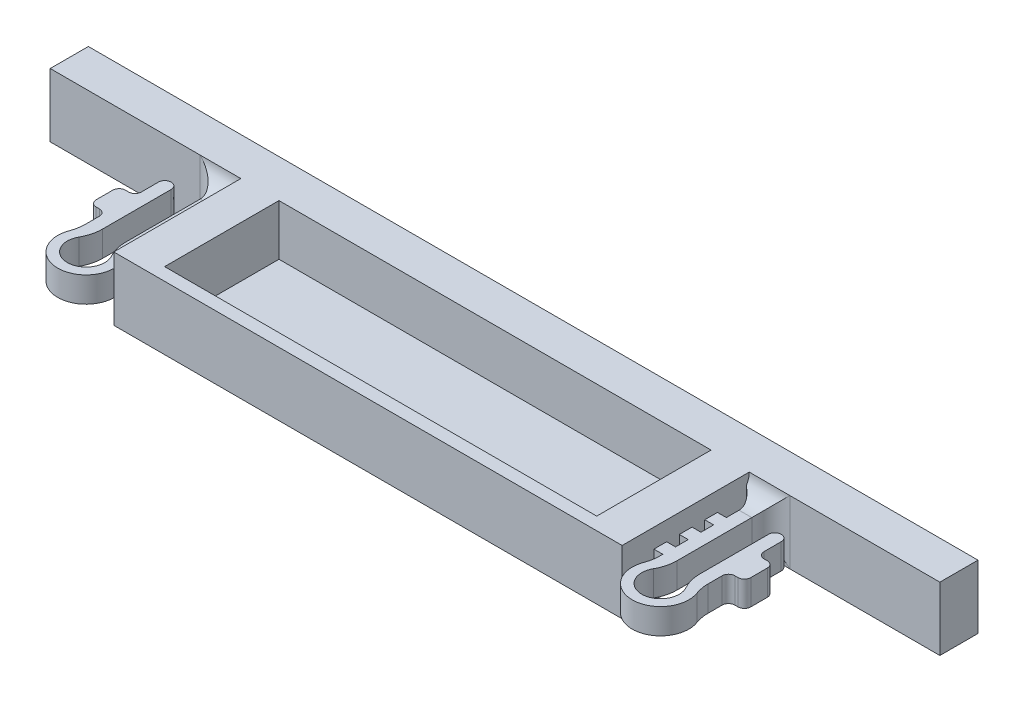
from build123d import *

# Parameters (mm, degrees)
BOSS_EXTRUDE1_DEPTH = 12.7
SKETCH6_W           = 86.36
SKETCH6_H           = 22.86
CUT_EXTRUDE3_DEPTH  = 10.16
SKETCH7_W           = 12.7
SKETCH7_H           = 25.4
CUT_EXTRUDE4_DEPTH  = 12.7
SKETCH14_W          = 88.9
SKETCH14_H          = 33.02
CUT_EXTRUDE5_DEPTH  = 19.558
BOSS_EXTRUDE2_START = -3.81
SKETCH15_W          = 2.54
SKETCH15_H          = 21.363451449
SKETCH15_W_2        = 3.175
SKETCH15_H_2        = 5.842
BOSS_EXTRUDE2_DEPTH = 5.08
FILLET1_R           = 7.62
FILLET2_R           = 1.27
FILLET3_R           = 3.81
BOSS_EXTRUDE3_START = -3.81
SKETCH16_W          = 1.778
SKETCH16_H          = 2.54
BOSS_EXTRUDE3_DEPTH = 5.08


# Some blends are built 0.0001 mm under size
with BuildPart() as part:
    # Sketch1 → Boss-Extrude1 (new body)
    with BuildSketch(Plane(origin=(0, 0, 0), x_dir=(1, 0, 0), z_dir=(0, 1, 0))):
        Polygon((88.9, 16.51), (-88.9, 16.51), (-88.9, 8.89), (-63.5, 8.89), (-63.5, -16.51), (63.5, -16.51), (63.5, 8.89), (88.9, 8.89), align=None)
    extrude(amount=BOSS_EXTRUDE1_DEPTH)

    # Sketch6 → Cut-Extrude3 (cut)
    with BuildSketch(Plane(origin=(0, 12.7, 0), x_dir=(1, 0, 0), z_dir=(0, 1, 0))):
        with Locations((0, -2.54)):
            Rectangle(SKETCH6_W, SKETCH6_H)
    extrude(amount=-CUT_EXTRUDE3_DEPTH, mode=Mode.SUBTRACT)

    # Sketch7 → Cut-Extrude4 (cut)
    with BuildSketch(Plane(origin=(0, 12.7, 0), x_dir=(1, 0, 0), z_dir=(0, 1, 0))):
        with Locations((57.15, -3.81)):
            Rectangle(SKETCH7_W, SKETCH7_H)
        with Locations((-57.15, -3.81)):
            Rectangle(SKETCH7_W, SKETCH7_H)
    extrude(amount=-CUT_EXTRUDE4_DEPTH, mode=Mode.SUBTRACT)

    # Sketch14 → Cut-Extrude5 (cut)
    with BuildSketch(Plane(origin=(0, 12.7, 0), x_dir=(1, 0, 0), z_dir=(0, 1, 0))):
        with Locations((44.45, 0)):
            Rectangle(SKETCH14_W, SKETCH14_H)
    extrude(amount=-CUT_EXTRUDE5_DEPTH, mode=Mode.SUBTRACT)

    # Sketch15 → Boss-Extrude2 (add)
    with BuildSketch(Plane(origin=(0, 12.7, 0), x_dir=(1, 0, 0), z_dir=(0, 1, 0)).offset(BOSS_EXTRUDE2_START)):
        with Locations((-53.848, -1.791725725)):
            Rectangle(SKETCH15_W, SKETCH15_H)
        with BuildLine():
            ThreePointArc((-59.69, -12.473451449), (-57.404, -19.184020308), (-55.118, -12.473451449))
            Line((-55.118, -12.473451449), (-52.578, -12.473451449))
            ThreePointArc((-52.578, -12.473451449), (-57.404, -21.103897158), (-62.23, -12.473451449))
            Line((-62.23, -12.473451449), (-62.23, 5.125982646))
            Line((-62.23, 5.125982646), (-59.69, 5.125982646))
            Line((-59.69, 5.125982646), (-59.69, -12.473451449))
        make_face()
        with Locations((-63.8175, -3.758774926)):
            Rectangle(SKETCH15_W_2, SKETCH15_H_2)
    extrude(amount=-BOSS_EXTRUDE2_DEPTH)

    # Fillet1
    fillet1_edges = [part.edges().sort_by_distance(p)[0] for p in [
        (-59.69, 6.35, 12.473451449),
        (-55.118, 6.35, 12.473451449),
        (-62.23, 6.35, 12.473451449),
        (-52.578, 6.35, 12.473451449),
    ]]
    fillet(fillet1_edges, radius=FILLET1_R)

    # Fillet2
    fillet2_edges = [part.edges().sort_by_distance(p)[0] for p in [
        (-62.23, 6.35, 6.679774926),
        (-65.405, 6.35, 6.679774926),
        (-65.405, 6.35, 0.837774926),
        (-62.23, 6.35, 0.837774926),
        (-59.69, 6.35, -5.125982646),
        (-62.23, 6.35, -5.125982646),
    ]]
    fillet(fillet2_edges, radius=FILLET2_R - 0.0001)  # a hair under: the kernel refuses the full size

    # Fillet3
    # the kernel refuses this fillet: 3.81 mm, written as the material it adds along each edge
    with BuildSketch(Plane(origin=(-52.578, 8.89, -8.89), x_dir=(0, 0, 1), z_dir=(0, -1, 0)), Plane(origin=(-55.118, 8.89, -8.89), x_dir=(-1, 0, 0), z_dir=(0, -1, 0))) as fillet3_piece_1:
        with BuildLine():
            CenterArc((FILLET3_R, -FILLET3_R), FILLET3_R, 90, 90)
            Line((0, -FILLET3_R), (-FILLET3_R * 0.02, -FILLET3_R))
            Line((-FILLET3_R * 0.02, -FILLET3_R), (-FILLET3_R * 0.02, FILLET3_R * 0.02))
            Line((-FILLET3_R * 0.02, FILLET3_R * 0.02), (FILLET3_R, FILLET3_R * 0.02))
            Line((FILLET3_R, FILLET3_R * 0.02), (FILLET3_R, 0))
        make_face()
    extrude(amount=5.08)
    with BuildSketch(Plane(origin=(-52.578, 3.81, -8.89), x_dir=(0, -1, 0), z_dir=(-1, 0, 0)), Plane(origin=(-52.578, 8.89, -8.89), x_dir=(0, 0, 1), z_dir=(-1, 0, 0))) as fillet3_piece_2:
        with BuildLine():
            CenterArc((FILLET3_R, FILLET3_R), FILLET3_R, 180, 90)
            Line((0, FILLET3_R), (-FILLET3_R * 0.02, FILLET3_R))
            Line((-FILLET3_R * 0.02, FILLET3_R), (-FILLET3_R * 0.02, -FILLET3_R * 0.02))
            Line((-FILLET3_R * 0.02, -FILLET3_R * 0.02), (FILLET3_R, -FILLET3_R * 0.02))
            Line((FILLET3_R, -FILLET3_R * 0.02), (FILLET3_R, 0))
        make_face()
    extrude(amount=2.54)
    with BuildSketch(Plane(origin=(-43.053, 8.89, -8.89), x_dir=(0, 0, 1), z_dir=(-1, 0, 0))) as fillet3_piece_3a_section:
        with BuildLine():
            CenterArc((FILLET3_R, FILLET3_R), FILLET3_R, 180, 90)
            Line((0, FILLET3_R), (-FILLET3_R * 0.02, FILLET3_R))
            Line((-FILLET3_R * 0.02, FILLET3_R), (-FILLET3_R * 0.02, -FILLET3_R * 0.02))
            Line((-FILLET3_R * 0.02, -FILLET3_R * 0.02), (FILLET3_R, -FILLET3_R * 0.02))
            Line((FILLET3_R, -FILLET3_R * 0.02), (FILLET3_R, 0))
        make_face()
    fillet3_piece_3a = extrude(amount=12.065, mode=Mode.PRIVATE)
    fillet3_piece_3a = split(fillet3_piece_3a, bisect_by=Plane(origin=(-52.578, 9.752565385, -8.027434615), z_dir=(1, 0, 0)), keep=Keep.TOP, mode=Mode.PRIVATE)
    with BuildSketch(Plane(origin=(-52.578, 18.415, -8.89), x_dir=(0, 0, 1), z_dir=(0, -1, 0))) as fillet3_piece_3b_section:
        with BuildLine():
            CenterArc((FILLET3_R, -FILLET3_R), FILLET3_R, 90, 90)
            Line((0, -FILLET3_R), (-FILLET3_R * 0.02, -FILLET3_R))
            Line((-FILLET3_R * 0.02, -FILLET3_R), (-FILLET3_R * 0.02, FILLET3_R * 0.02))
            Line((-FILLET3_R * 0.02, FILLET3_R * 0.02), (FILLET3_R, FILLET3_R * 0.02))
            Line((FILLET3_R, FILLET3_R * 0.02), (FILLET3_R, 0))
        make_face()
    fillet3_piece_3b = extrude(amount=14.605, mode=Mode.PRIVATE)
    fillet3_piece_3b = split(fillet3_piece_3b, bisect_by=Plane(origin=(-51.715434615, 8.89, -8.027434615), z_dir=(0, 1, 0)), keep=Keep.TOP, mode=Mode.PRIVATE)
    fillet3_piece_3 = fillet3_piece_3a & fillet3_piece_3b
    add(fillet3_piece_3)
    with BuildSketch(Plane(origin=(-52.578, 8.89, -8.89), x_dir=(0, 0, 1), z_dir=(0, -1, 0))) as fillet3_piece_4a_section:
        with BuildLine():
            CenterArc((FILLET3_R, -FILLET3_R), FILLET3_R, 90, 90)
            Line((0, -FILLET3_R), (-FILLET3_R * 0.02, -FILLET3_R))
            Line((-FILLET3_R * 0.02, -FILLET3_R), (-FILLET3_R * 0.02, FILLET3_R * 0.02))
            Line((-FILLET3_R * 0.02, FILLET3_R * 0.02), (FILLET3_R, FILLET3_R * 0.02))
            Line((FILLET3_R, FILLET3_R * 0.02), (FILLET3_R, 0))
        make_face()
    fillet3_piece_4a = extrude(amount=14.605, mode=Mode.PRIVATE)
    fillet3_piece_4a = split(fillet3_piece_4a, bisect_by=Plane(origin=(-51.715434615, 3.81, -8.027434615), z_dir=(0, -1, 0)), keep=Keep.TOP, mode=Mode.PRIVATE)
    with BuildSketch(Plane(origin=(-43.053, 3.81, -8.89), x_dir=(0, -1, 0), z_dir=(-1, 0, 0))) as fillet3_piece_4b_section:
        with BuildLine():
            CenterArc((FILLET3_R, FILLET3_R), FILLET3_R, 180, 90)
            Line((0, FILLET3_R), (-FILLET3_R * 0.02, FILLET3_R))
            Line((-FILLET3_R * 0.02, FILLET3_R), (-FILLET3_R * 0.02, -FILLET3_R * 0.02))
            Line((-FILLET3_R * 0.02, -FILLET3_R * 0.02), (FILLET3_R, -FILLET3_R * 0.02))
            Line((FILLET3_R, -FILLET3_R * 0.02), (FILLET3_R, 0))
        make_face()
    fillet3_piece_4b = extrude(amount=12.065, mode=Mode.PRIVATE)
    fillet3_piece_4b = split(fillet3_piece_4b, bisect_by=Plane(origin=(-52.578, 2.947434615, -8.027434615), z_dir=(1, 0, 0)), keep=Keep.TOP, mode=Mode.PRIVATE)
    fillet3_piece_4 = fillet3_piece_4a & fillet3_piece_4b
    add(fillet3_piece_4)
    with BuildSketch(Plane(origin=(-52.578, 8.89, -8.89), x_dir=(0, 0, 1), z_dir=(-1, 0, 0))) as fillet3_piece_5a_section:
        with BuildLine():
            CenterArc((FILLET3_R, FILLET3_R), FILLET3_R, 180, 90)
            Line((0, FILLET3_R), (-FILLET3_R * 0.02, FILLET3_R))
            Line((-FILLET3_R * 0.02, FILLET3_R), (-FILLET3_R * 0.02, -FILLET3_R * 0.02))
            Line((-FILLET3_R * 0.02, -FILLET3_R * 0.02), (FILLET3_R, -FILLET3_R * 0.02))
            Line((FILLET3_R, -FILLET3_R * 0.02), (FILLET3_R, 0))
        make_face()
    fillet3_piece_5a = extrude(amount=12.065, mode=Mode.PRIVATE)
    fillet3_piece_5a = split(fillet3_piece_5a, bisect_by=Plane(origin=(-55.118, 9.752565385, -8.027434615), z_dir=(-1, 0, 0)), keep=Keep.TOP, mode=Mode.PRIVATE)
    with BuildSketch(Plane(origin=(-55.118, 18.415, -8.89), x_dir=(-1, 0, 0), z_dir=(0, -1, 0))) as fillet3_piece_5b_section:
        with BuildLine():
            CenterArc((FILLET3_R, -FILLET3_R), FILLET3_R, 90, 90)
            Line((0, -FILLET3_R), (-FILLET3_R * 0.02, -FILLET3_R))
            Line((-FILLET3_R * 0.02, -FILLET3_R), (-FILLET3_R * 0.02, FILLET3_R * 0.02))
            Line((-FILLET3_R * 0.02, FILLET3_R * 0.02), (FILLET3_R, FILLET3_R * 0.02))
            Line((FILLET3_R, FILLET3_R * 0.02), (FILLET3_R, 0))
        make_face()
    fillet3_piece_5b = extrude(amount=14.605, mode=Mode.PRIVATE)
    fillet3_piece_5b = split(fillet3_piece_5b, bisect_by=Plane(origin=(-55.980565385, 8.89, -8.027434615), z_dir=(0, 1, 0)), keep=Keep.TOP, mode=Mode.PRIVATE)
    fillet3_piece_5 = fillet3_piece_5a & fillet3_piece_5b
    add(fillet3_piece_5)
    with BuildSketch(Plane(origin=(-52.578, 3.81, -8.89), x_dir=(0, -1, 0), z_dir=(-1, 0, 0))) as fillet3_piece_6a_section:
        with BuildLine():
            CenterArc((FILLET3_R, FILLET3_R), FILLET3_R, 180, 90)
            Line((0, FILLET3_R), (-FILLET3_R * 0.02, FILLET3_R))
            Line((-FILLET3_R * 0.02, FILLET3_R), (-FILLET3_R * 0.02, -FILLET3_R * 0.02))
            Line((-FILLET3_R * 0.02, -FILLET3_R * 0.02), (FILLET3_R, -FILLET3_R * 0.02))
            Line((FILLET3_R, -FILLET3_R * 0.02), (FILLET3_R, 0))
        make_face()
    fillet3_piece_6a = extrude(amount=12.065, mode=Mode.PRIVATE)
    fillet3_piece_6a = split(fillet3_piece_6a, bisect_by=Plane(origin=(-55.118, 2.947434615, -8.027434615), z_dir=(-1, 0, 0)), keep=Keep.TOP, mode=Mode.PRIVATE)
    with BuildSketch(Plane(origin=(-55.118, 8.89, -8.89), x_dir=(-1, 0, 0), z_dir=(0, -1, 0))) as fillet3_piece_6b_section:
        with BuildLine():
            CenterArc((FILLET3_R, -FILLET3_R), FILLET3_R, 90, 90)
            Line((0, -FILLET3_R), (-FILLET3_R * 0.02, -FILLET3_R))
            Line((-FILLET3_R * 0.02, -FILLET3_R), (-FILLET3_R * 0.02, FILLET3_R * 0.02))
            Line((-FILLET3_R * 0.02, FILLET3_R * 0.02), (FILLET3_R, FILLET3_R * 0.02))
            Line((FILLET3_R, FILLET3_R * 0.02), (FILLET3_R, 0))
        make_face()
    fillet3_piece_6b = extrude(amount=14.605, mode=Mode.PRIVATE)
    fillet3_piece_6b = split(fillet3_piece_6b, bisect_by=Plane(origin=(-55.980565385, 3.81, -8.027434615), z_dir=(0, -1, 0)), keep=Keep.TOP, mode=Mode.PRIVATE)
    fillet3_piece_6 = fillet3_piece_6a & fillet3_piece_6b
    add(fillet3_piece_6)

    # Sketch16 → Boss-Extrude3 (add)
    with BuildSketch(Plane(origin=(0, 12.7, 0), x_dir=(1, 0, 0), z_dir=(0, 1, 0)).offset(BOSS_EXTRUDE3_START)):
        with Locations((-51.689, 1.27)):
            Rectangle(SKETCH16_W, SKETCH16_H)
        with Locations((-51.689, -3.81)):
            Rectangle(SKETCH16_W, SKETCH16_H)
        with Locations((-51.689, -8.89)):
            Rectangle(SKETCH16_W, SKETCH16_H)
    extrude(amount=-BOSS_EXTRUDE3_DEPTH)

    # Mirror1: part across plane


with BuildPart() as part_1:
    add(part.part)
    add(part.part.mirror(Plane(origin=(0, -6.858, -16.51), x_dir=(0, 0, 1), z_dir=(-1, 0, 0))))


solid = part_1.part
